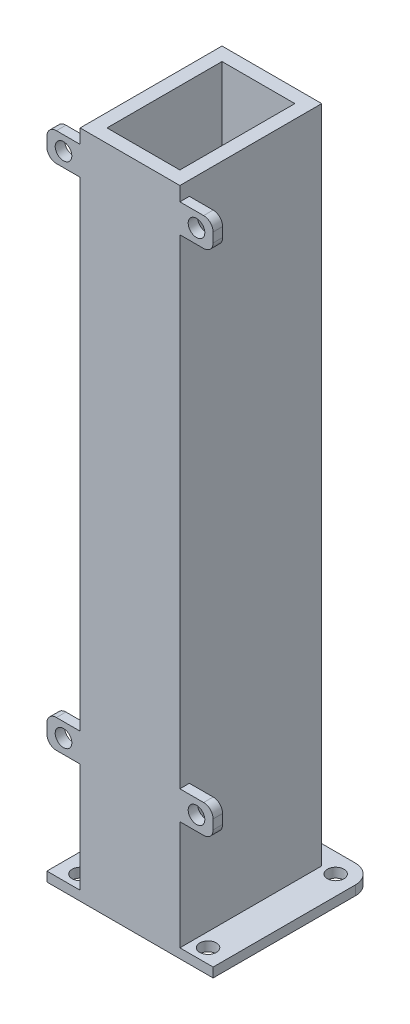
from build123d import *

# Parameters (mm, degrees)
ESQUISSE1_W                   = 35
ESQUISSE1_H                   = 35
BOSS_EXTRU_1_DEPTH            = 2
ESQUISSE2_R                   = 1.75
ESQUISSE2_W                   = 35
ESQUISSE2_H                   = 1.064971157
ENL_V_MAT_EXTRU_1_DEPTH       = 2
BOSS_EXTRU_2_DEPTH            = 280
ESQUISSE5_W                   = 7
ESQUISSE5_H                   = 6
ESQUISSE5_R                   = 1.75
BOSS_EXTRU_3_DEPTH            = 2
ESQUISSE6_R                   = 1.75
BOSS_EXTRU_4_DEPTH            = 2
ESQUISSE10_W                  = 35
ESQUISSE10_H                  = 33.935028843
ESQUISSE10_R                  = 1.75
BOSS_EXTRU_5_DEPTH            = 2
ESQUISSE15_R                  = 6.5
ESQUISSE15_R_2                = 1.75
ENL_V_MAT_EXTRU_2_DEPTH       = 373
CONG_1_R                      = 2
CONG_2_R                      = 4
EXTRU_MINCE1_START            = -2
EXTRU_MINCE1_OUTLINE_W        = 35
EXTRU_MINCE1_OUTLINE_H        = 10
EXTRU_MINCE1_DEPTH            = 2
BOSS_EXTRU_7_DEPTH            = 62.5
BOSS_EXTRU_8_DEPTH            = 160
ENL_V_MAT_EXTRU_4_DEPTH       = 15
BOSS_EXTRU_31_DEPTH           = 69.5
BOSS_EXTRU_31_DEPTH_BACK      = 90.5
ESQUISSE29_W                  = 0.210775501
ESQUISSE29_H                  = 2
BOSS_EXTRU_32_DEPTH           = 160
ENL_V_MAT_EXTRU_7_DEPTH       = 10
ENL_V_MAT_EXTRU_7_DEPTH_BACK  = 5
ESQUISSE34_W                  = 144
ESQUISSE34_H                  = 64.710678118
ENL_V_MAT_EXTRU_8_DEPTH       = 2
ESQUISSE35_R                  = 1.5
BOSS_EXTRU_35_DEPTH           = 2
BOSS_EXTRU_36_START           = -2
ESQUISSE36_R                  = 1.5
BOSS_EXTRU_36_DEPTH           = 2
BOSS_EXTRU_37_DEPTH           = 21
BOSS_EXTRU_38_DEPTH           = 28
ESQUISSE42_W                  = 17
ESQUISSE42_H                  = 6
ENL_V_MAT_EXTRU_9_DEPTH       = 124
ESQUISSE43_R                  = 1.1
ENL_V_MAT_EXTRU_11_DEPTH      = 50
ESQUISSE45_R                  = 1.5
ENL_V_MAT_EXTRU_12_DEPTH      = 50
ESQUISSE47_R                  = 1.75
BOSS_EXTRU_40_DEPTH           = 2
ENL_V_MAT_EXTRU_13_DEPTH      = 2
ESQUISSE49_R                  = 1.75
BOSS_EXTRU_41_DEPTH           = 2
ESQUISSE50_W                  = 12.927363302
ESQUISSE50_H                  = 18
ENL_V_MAT_EXTRU_14_DEPTH      = 2
ESQUISSE51_R                  = 1.75
BOSS_EXTRU_42_DEPTH           = 2
ENL_V_MAT_EXTRU_15_DEPTH      = 1000
ENL_V_MAT_EXTRU_15_DEPTH_BACK = 1000
ESQUISSE53_W                  = 15.34314575
ESQUISSE53_H                  = 24.213203648
ENL_V_MAT_EXTRU_16_DEPTH      = 20


# Read off the part's stored shape, not the designer's step: Extru.-Mince1
with BuildPart() as part:
    # Esquisse1 → Boss.-Extru.1 (new body)
    with BuildSketch(Plane(origin=(0, 0, 0), x_dir=(1, 0, 0), z_dir=(0, 1, 0))):
        with Locations((17.5, -17.5)):
            Rectangle(ESQUISSE1_W, ESQUISSE1_H)
    extrude(amount=BOSS_EXTRU_1_DEPTH)

    # Esquisse2 → Enlèv. mat.-Extru.1 (cut)
    with BuildSketch(Plane(origin=(0, 2, 0), x_dir=(1, 0, 0), z_dir=(0, 1, 0))):
        with Locations(Location((30.935029054, -4.064971369, 0), (0, 0, 270))):
            Circle(ESQUISSE2_R)
        with Locations(Location((30.935028843, -30.935028843, 0), (0, 0, 270))):
            Circle(ESQUISSE2_R)
        with Locations(Location((4.064971369, -4.064970946, 0), (0, 0, 270))):
            Circle(ESQUISSE2_R)
        with Locations(Location((4.064971157, -30.935028843, 0), (0, 0, 270))):
            Circle(ESQUISSE2_R)
        with Locations((17.5, -34.467514421)):
            Rectangle(ESQUISSE2_W, ESQUISSE2_H)
    extrude(amount=-ENL_V_MAT_EXTRU_1_DEPTH, mode=Mode.SUBTRACT)

    # Esquisse4 → Boss.-Extru.2 (add)
    with BuildSketch(Plane(origin=(0, 2, 0), x_dir=(1, 0, 0), z_dir=(0, 1, 0))):
        Polygon((17.5, -33.935028843), (7, -33.935028843), (7, -4.064970946), (28, -4.064970946), (28, -33.935028843), align=None)
    extrude(amount=BOSS_EXTRU_2_DEPTH)

    # Esquisse5 → Boss.-Extru.3 (add)
    # profile 1 of 4: a face of its own
    with BuildSketch(Plane.XY.offset(33.935028843)):
        with Locations((31.5, 254)):
            Rectangle(ESQUISSE5_W, ESQUISSE5_H)
        with Locations((31.5, 254)):
            Circle(ESQUISSE5_R, mode=Mode.SUBTRACT)
    # profile 2 of 4: a face of its own
    with BuildSketch(Plane.XY.offset(33.935028843)):
        with Locations((3.5, 254)):
            Rectangle(ESQUISSE5_W, ESQUISSE5_H)
        with Locations((3.5, 254)):
            Circle(ESQUISSE5_R, mode=Mode.SUBTRACT)
    # profile 3 of 4: a face of its own
    with BuildSketch(Plane.XY.offset(33.935028843)):
        with Locations((31.5, 28)):
            Rectangle(ESQUISSE5_W, ESQUISSE5_H)
        with Locations((31.5, 28)):
            Circle(ESQUISSE5_R, mode=Mode.SUBTRACT)
    # profile 4 of 4: a face of its own
    with BuildSketch(Plane.XY.offset(33.935028843)):
        with Locations((3.5, 28)):
            Rectangle(ESQUISSE5_W, ESQUISSE5_H)
        with Locations((3.5, 28)):
            Circle(ESQUISSE5_R, mode=Mode.SUBTRACT)
    extrude(amount=-BOSS_EXTRU_3_DEPTH)

    # Esquisse6 → Boss.-Extru.4 (add)
    # profile 1 of 2: a face of its own
    with BuildSketch(Plane.XY.offset(33.935028843)):
        Polygon((7, 144), (0, 144), (0, 141), (0, 138), (7, 138), (7, 141), align=None)
        with Locations((3.5, 141)):
            Circle(ESQUISSE6_R, mode=Mode.SUBTRACT)
    # profile 2 of 2: a face of its own
    with BuildSketch(Plane.XY.offset(33.935028843)):
        Polygon((35, 144), (28, 144), (28, 141), (28, 138), (35, 138), (35, 141), align=None)
        with Locations((31.5, 141)):
            Circle(ESQUISSE6_R, mode=Mode.SUBTRACT)
    extrude(amount=-BOSS_EXTRU_4_DEPTH)

    # Esquisse10 → Boss.-Extru.5 (add)
    with BuildSketch(Plane(origin=(0, 282, 0), x_dir=(1, 0, 0), z_dir=(0, 1, 0))):
        with Locations((17.5, -16.967514422)):
            Rectangle(ESQUISSE10_W, ESQUISSE10_H)
        with Locations(Location((30.935028843, -30.935028843, 0), (0, 0, 270))):
            Circle(ESQUISSE10_R, mode=Mode.SUBTRACT)
        with Locations(Location((30.935028631, -4.064970946, 0), (0, 0, 270.000013863))):
            Circle(ESQUISSE10_R, mode=Mode.SUBTRACT)
        with Locations(Location((4.064970946, -4.064971369, 0), (0, 0, 270.000013863))):
            Circle(ESQUISSE10_R, mode=Mode.SUBTRACT)
        with Locations(Location((4.064971157, -30.935028843, 0), (0, 0, 270))):
            Circle(ESQUISSE10_R, mode=Mode.SUBTRACT)
    extrude(amount=-BOSS_EXTRU_5_DEPTH)

    # Esquisse15 → Enlèv. mat.-Extru.2 (cut)
    with BuildSketch(Plane(origin=(0, 282, 0), x_dir=(1, 0, 0), z_dir=(0, 1, 0))):
        with Locations(Location((17.5, -17.5, 0), (0, 0, 270))):
            Circle(ESQUISSE15_R)
        with Locations(Location((30.935029054, -4.064971369, 0), (0, 0, 270))):
            Circle(ESQUISSE15_R_2)
    extrude(amount=-ENL_V_MAT_EXTRU_2_DEPTH, mode=Mode.SUBTRACT)

    # Congé1
    cong_1_edges = [part.edges().sort_by_distance(p)[0] for p in [
        (0, 31, 32.935028843),
        (0, 25, 32.935028843),
        (0, 144, 32.935028843),
        (0, 138, 32.935028843),
        (35, 144, 32.935028843),
        (35, 138, 32.935028843),
        (35, 257, 32.935028843),
        (35, 251, 32.935028843),
        (0, 251, 32.935028843),
        (0, 257, 32.935028843),
        (35, 31, 32.935028843),
        (35, 25, 32.935028843),
    ]]
    fillet(cong_1_edges, radius=CONG_1_R)

    # Congé2
    cong_2_edges = [part.edges().sort_by_distance(p)[0] for p in [
        (35, 281, 0),
        (0, 281, 0),
        (0, 1, 0),
        (35, 1, 0),
    ]]
    fillet(cong_2_edges, radius=CONG_2_R)

    # Extru.-Mince1 outline → Extru.-Mince1 (add)
    with BuildSketch(Plane(origin=(0, 282, 0), x_dir=(1, 0, 0), z_dir=(0, 1, 0)).offset(EXTRU_MINCE1_START)):
        with Locations((17.5, -38.935028843)):
            Rectangle(EXTRU_MINCE1_OUTLINE_W, EXTRU_MINCE1_OUTLINE_H)
    extrude(amount=EXTRU_MINCE1_DEPTH)

    # Esquisse20 → Boss.-Extru.7 (add)
    with BuildSketch(Plane.ZY):
        Polygon((43.935028843, 282), (114.645706961, 211.289321881), (110.645706961, 211.289321881), (41.935028843, 280), (34.145804344, 280), (34.145804344, 282), align=None)
    extrude(amount=BOSS_EXTRU_7_DEPTH)

    # Esquisse21 → Boss.-Extru.8 (add)
    with BuildSketch(Plane.ZY.offset(62.5)):
        Polygon((34.145804344, 280), (41.935028843, 280), (110.645706961, 211.289321881), (114.645706961, 211.289321881), (43.935028843, 282), (34.145804344, 282), align=None)
    extrude(amount=-BOSS_EXTRU_8_DEPTH)

    # Esquisse22 → Enlèv. mat.-Extru.4 (cut)
    with BuildSketch(Plane(origin=(0, 162.967514421, 162.967514421), x_dir=(1, 0, 0), z_dir=(0, 0.7071067811865462, 0.7071067811865488))):
        Polygon((-42.064466094, 147.626821562), (-45.6, 147.626821562), (-45.6, 89.047889374), (-42.064466094, 89.047889374), (-42.064466094, 85.512355468), (77.064466094, 85.512355468), (77.064466094, 89.047889374), (80.6, 89.047889374), (80.6, 147.626821562), (77.064466094, 147.626821562), (77.064466094, 151.162355468), (-42.064466094, 151.162355468), align=None)
    extrude(amount=-ENL_V_MAT_EXTRU_4_DEPTH, mode=Mode.SUBTRACT)

    # Esquisse29 → Boss.-Extru.31 (add, two sides: drawn at the far end of the back side and taken through both)
    with BuildSketch(Plane.ZY.offset(-7).offset(-BOSS_EXTRU_31_DEPTH_BACK)):
        with Locations((34.040416594, 281)):
            Rectangle(ESQUISSE29_W, ESQUISSE29_H)
    extrude(amount=BOSS_EXTRU_31_DEPTH + BOSS_EXTRU_31_DEPTH_BACK)

    # Esquisse32 → Boss.-Extru.32 (add)
    with BuildSketch(Plane.ZY.offset(62.5)):
        Polygon((110.645706961, 211.289321881), (33.935028843, 211.289321881), (33.935028843, 280), (35.935028843, 280), (35.935028843, 213.289321881), (108.645706961, 213.289321881), align=None)
    extrude(amount=-BOSS_EXTRU_32_DEPTH)

    # Esquisse33 → Enlèv. mat.-Extru.7 (cut, two sides: drawn at the far end of the back side and taken through both)
    with BuildSketch(Plane(origin=(0, 0, 33.935028843), x_dir=(-1, 0, 0), z_dir=(0, 0, -1)).offset(-ENL_V_MAT_EXTRU_7_DEPTH_BACK)):
        Polygon((-28, 274.000000001), (-89.5, 274.000000001), (-89.5, 219.289321881), (-81.5, 219.289321881), (-28, 219.289321881), align=None)
        with BuildLine():
            Line((54.5, 274.000000001), (-7, 274.000000001))
            Line((-7, 274.000000001), (-7, 257))
            Line((-7, 257), (-2, 257))
            ThreePointArc((-2, 257), (-0.585786438, 256.414213562), (0, 255))
            Line((0, 255), (0, 253))
            ThreePointArc((0, 253), (-0.585786438, 251.585786438), (-2, 251))
            Line((-2, 251), (-7, 251))
            Line((-7, 251), (-7, 219.289321881))
            Line((-7, 219.289321881), (1, 219.289321881))
            Line((1, 219.289321881), (54.5, 219.289321881))
            Line((54.5, 219.289321881), (54.5, 274.000000001))
        make_face()
        with BuildLine():
            Line((-2, 257), (-7, 257))
            Line((-7, 257), (-7, 251))
            Line((-7, 251), (-2, 251))
            ThreePointArc((-2, 251), (-0.585786438, 251.585786438), (0, 253))
            Line((0, 253), (0, 255))
            ThreePointArc((0, 255), (-0.585786438, 256.414213562), (-2, 257))
        make_face()
    extrude(amount=ENL_V_MAT_EXTRU_7_DEPTH + ENL_V_MAT_EXTRU_7_DEPTH_BACK, mode=Mode.SUBTRACT)

    # Esquisse34 → Enlèv. mat.-Extru.8 (cut)
    with BuildSketch(Plane.XZ.offset(-211.289321881)):
        with Locations((17.5, 74.290367902)):
            Rectangle(ESQUISSE34_W, ESQUISSE34_H)
    extrude(amount=-ENL_V_MAT_EXTRU_8_DEPTH, mode=Mode.SUBTRACT)

    # Esquisse35 → Boss.-Extru.35 (add)
    with BuildSketch(Plane(origin=(97.5, 0, 0), x_dir=(0, 0, -1), z_dir=(1, 0, 0))):
        Polygon((-35.935028843, 280), (-35.935028843, 274.000000001), (-35.935028843, 213.289321881), (-108.645706961, 213.289321881), (-102.645706961, 219.289321881), (-41.935028842, 219.289321881), (-41.935028842, 274.000000001), (-47.935028841, 274.000000001), (-41.935028843, 280), align=None)
        with Locations((-38.935028842, 216.289321881)):
            Circle(ESQUISSE35_R, mode=Mode.SUBTRACT)
        with Locations((-38.935028842, 277.000000001)):
            Circle(ESQUISSE35_R, mode=Mode.SUBTRACT)
        with Locations((-99.645706961, 216.289321881)):
            Circle(ESQUISSE35_R, mode=Mode.SUBTRACT)
    extrude(amount=-BOSS_EXTRU_35_DEPTH)

    # Esquisse36 → Boss.-Extru.36 (add)
    with BuildSketch(Plane.ZY.offset(62.5).offset(BOSS_EXTRU_36_START)):
        Polygon((35.935028843, 213.289321881), (108.645706961, 213.289321881), (102.645706961, 219.289321881), (41.935028842, 219.289321881), (41.935028842, 274.000000001), (47.935028841, 274.000000001), (41.935028843, 280), (35.935028843, 280), (35.935028843, 274.000000001), align=None)
        with Locations(Location((99.645706961, 216.289321881, 0), (0, 0, 180))):
            Circle(ESQUISSE36_R, mode=Mode.SUBTRACT)
        with Locations(Location((38.935028842, 277.000000001, 0), (0, 0, 180))):
            Circle(ESQUISSE36_R, mode=Mode.SUBTRACT)
        with Locations(Location((38.935028842, 216.289321881, 0), (0, 0, 180))):
            Circle(ESQUISSE36_R, mode=Mode.SUBTRACT)
    extrude(amount=BOSS_EXTRU_36_DEPTH)

    # Esquisse39 → Boss.-Extru.37 (add)
    with BuildSketch(Plane(origin=(28, 0, 0), x_dir=(0, 0, -1), z_dir=(1, 0, 0))):
        Polygon((-33.935028843, 211.289321881), (-33.935028843, 191.289321881), (-118.935028843, 201.289321881), (-118.935028843, 211.289321881), align=None)
    extrude(amount=-BOSS_EXTRU_37_DEPTH)

    # Esquisse40 → Boss.-Extru.38 (add)
    with BuildSketch(Plane.XY.offset(118.935028843)):
        Polygon((7, 201.289321881), (2, 201.289321881), (2, 203.289321881), (33, 203.289321881), (33, 201.289321881), (28, 201.289321881), align=None)
    extrude(amount=BOSS_EXTRU_38_DEPTH)

    # Esquisse42 → Enlèv. mat.-Extru.9 (cut)
    with BuildSketch(Plane.XY.offset(118.935028843)):
        with Locations((17.5, 208.289321881)):
            Rectangle(ESQUISSE42_W, ESQUISSE42_H)
    extrude(amount=-ENL_V_MAT_EXTRU_9_DEPTH, mode=Mode.SUBTRACT)

    # Esquisse43 → Enlèv. mat.-Extru.11 (cut)
    with BuildSketch(Plane(origin=(0, 203.289321881, 0), x_dir=(1, 0, 0), z_dir=(0, 1, 0))):
        with Locations(Location((5, -144.935028843, 0), (0, 0, 270))):
            Circle(ESQUISSE43_R)
        with Locations(Location((30, -144.935028843, 0), (0, 0, 270))):
            Circle(ESQUISSE43_R)
        with Locations(Location((5, -130.435028843, 0), (0, 0, 270))):
            Circle(ESQUISSE43_R)
        with Locations(Location((30, -130.435028843, 0), (0, 0, 270))):
            Circle(ESQUISSE43_R)
        with BuildLine():
            Line((5, -123.319506434), (5, -128.435028843))
            ThreePointArc((5, -128.435028843), (7, -130.435028843), (5, -132.435028843))
            Line((5, -132.435028843), (5, -142.935028843))
            ThreePointArc((5, -142.935028843), (6.414213562, -143.52081528), (7, -144.935028843))
            Line((7, -144.935028843), (28, -144.935028843))
            ThreePointArc((28, -144.935028843), (28.585786438, -143.52081528), (30, -142.935028843))
            Line((30, -142.935028843), (30, -132.435028843))
            ThreePointArc((30, -132.435028843), (28, -130.435028843), (30, -128.435028843))
            Line((30, -128.435028843), (30, -123.319506434))
            Line((30, -123.319506434), (5, -123.319506434))
        make_face()
    extrude(amount=-ENL_V_MAT_EXTRU_11_DEPTH, mode=Mode.SUBTRACT)

    # Esquisse45 → Enlèv. mat.-Extru.12 (cut)
    with BuildSketch(Plane(origin=(0, 162.967514421, 162.967514421), x_dir=(1, 0, 0), z_dir=(0, 0.7071067811865462, 0.7071067811865488))):
        with Locations(Location((80.6, 151.162355468, 0), (0, 0, 270))):
            Circle(ESQUISSE45_R)
        with Locations(Location((80.6, 85.512355468, 0), (0, 0, 270))):
            Circle(ESQUISSE45_R)
        with Locations(Location((-45.6, 85.512355468, 0), (0, 0, 270))):
            Circle(ESQUISSE45_R)
        with Locations(Location((-45.6, 151.162355468, 0), (0, 0, 270))):
            Circle(ESQUISSE45_R)
    extrude(amount=-ENL_V_MAT_EXTRU_12_DEPTH, mode=Mode.SUBTRACT)

    # Esquisse47 → Boss.-Extru.40 (add)
    # profile 1 of 4: a face of its own
    with BuildSketch(Plane.XY.offset(33.935028843)):
        with BuildLine():
            Line((2, 144), (7, 144))
            Line((7, 144), (7, 150))
            Line((7, 150), (2, 150))
            ThreePointArc((2, 150), (0.585786438, 149.414213562), (0, 148))
            Line((0, 148), (0, 146))
            ThreePointArc((0, 146), (0.585786438, 144.585786438), (2, 144))
        make_face()
        with Locations((3.5, 147)):
            Circle(ESQUISSE47_R, mode=Mode.SUBTRACT)
    # profile 2 of 4: a face of its own
    with BuildSketch(Plane.XY.offset(33.935028843)):
        with BuildLine():
            Line((28, 150), (28, 144))
            Line((28, 144), (33, 144))
            ThreePointArc((33, 144), (34.414213562, 144.585786438), (35, 146))
            Line((35, 146), (35, 148))
            ThreePointArc((35, 148), (34.414213562, 149.414213562), (33, 150))
            Line((33, 150), (28, 150))
        make_face()
        with Locations((31.5, 147)):
            Circle(ESQUISSE47_R, mode=Mode.SUBTRACT)
    # profile 3 of 4: a face of its own
    with BuildSketch(Plane.XY.offset(33.935028843)):
        with BuildLine():
            Line((35, 134), (35, 136))
            ThreePointArc((35, 136), (34.414213562, 137.414213562), (33, 138))
            Line((33, 138), (28, 138))
            Line((28, 138), (28, 132))
            Line((28, 132), (33, 132))
            ThreePointArc((33, 132), (34.414213562, 132.585786438), (35, 134))
        make_face()
        with Locations((31.5, 135)):
            Circle(ESQUISSE47_R, mode=Mode.SUBTRACT)
    # profile 4 of 4: a face of its own
    with BuildSketch(Plane.XY.offset(33.935028843)):
        with BuildLine():
            Line((7, 138), (2, 138))
            ThreePointArc((2, 138), (0.585786438, 137.414213562), (0, 136))
            Line((0, 136), (0, 134))
            ThreePointArc((0, 134), (0.585786438, 132.585786438), (2, 132))
            Line((2, 132), (7, 132))
            Line((7, 132), (7, 138))
        make_face()
        with Locations((3.5, 135)):
            Circle(ESQUISSE47_R, mode=Mode.SUBTRACT)
    extrude(amount=-BOSS_EXTRU_40_DEPTH)

    # Esquisse48 → Enlèv. mat.-Extru.13 (cut)
    with BuildSketch(Plane.XY.offset(33.935028843)):
        Polygon((-4.556540033, 144), (-4.556540033, 138), (2, 138), (7, 138), (7, 144), (2, 144), align=None)
        Polygon((33.295178048, 144), (39.851718081, 144), (39.851718081, 138), (33.295178048, 138), (28.295178048, 138), (28.295178048, 144), align=None)
    extrude(amount=-ENL_V_MAT_EXTRU_13_DEPTH, mode=Mode.SUBTRACT)

    # Esquisse49 → Boss.-Extru.41 (add)
    # profile 1 of 2: a face of its own
    with BuildSketch(Plane.XY.offset(33.935028843)):
        with BuildLine():
            Line((2, 180.289321881), (7, 180.289321881))
            Line((7, 180.289321881), (7, 186.289321881))
            Line((7, 186.289321881), (2, 186.289321881))
            ThreePointArc((2, 186.289321881), (0.585786438, 185.703535444), (0, 184.289321881))
            Line((0, 184.289321881), (0, 182.289321881))
            ThreePointArc((0, 182.289321881), (0.585786438, 180.875108319), (2, 180.289321881))
        make_face()
        with Locations((3.5, 183.289321881)):
            Circle(ESQUISSE49_R, mode=Mode.SUBTRACT)
    # profile 2 of 2: a face of its own
    with BuildSketch(Plane.XY.offset(33.935028843)):
        with BuildLine():
            Line((35, 182.289321881), (35, 184.289321881))
            ThreePointArc((35, 184.289321881), (34.414213562, 185.703535444), (33, 186.289321881))
            Line((33, 186.289321881), (28, 186.289321881))
            Line((28, 186.289321881), (28, 180.289321881))
            Line((28, 180.289321881), (33, 180.289321881))
            ThreePointArc((33, 180.289321881), (34.414213562, 180.875108319), (35, 182.289321881))
        make_face()
        with Locations((31.5, 183.289321881)):
            Circle(ESQUISSE49_R, mode=Mode.SUBTRACT)
    extrude(amount=-BOSS_EXTRU_41_DEPTH)

    # Esquisse50 → Enlèv. mat.-Extru.14 (cut)
    with BuildSketch(Plane.XY.offset(33.935028843)):
        with Locations((34.463681651, 141)):
            Rectangle(ESQUISSE50_W, ESQUISSE50_H)
    extrude(amount=-ENL_V_MAT_EXTRU_14_DEPTH, mode=Mode.SUBTRACT)

    # Esquisse51 → Boss.-Extru.42 (add)
    # profile 1 of 3: a face of its own
    with BuildSketch(Plane.XY.offset(33.935028843)):
        with BuildLine():
            Line((7, 150), (7, 144))
            Line((7, 144), (2, 144))
            ThreePointArc((2, 144), (0.585786438, 144.585786438), (0, 146))
            Line((0, 146), (0, 148))
            ThreePointArc((0, 148), (0.585786438, 149.414213562), (2, 150))
            Line((2, 150), (7, 150))
        make_face()
        with Locations((3.5, 147)):
            Circle(ESQUISSE51_R, mode=Mode.SUBTRACT)
    # profile 2 of 3: a face of its own
    with BuildSketch(Plane.XY.offset(33.935028843)):
        with BuildLine():
            Line((33, 138.018442997), (28, 138.018442997))
            Line((28, 138.018442997), (28, 132.018442997))
            Line((28, 132.018442997), (33, 132.018442997))
            ThreePointArc((33, 132.018442997), (34.414213562, 132.604229434), (35, 134.018442997))
            Line((35, 134.018442997), (35, 136.018442997))
            ThreePointArc((35, 136.018442997), (34.414213562, 137.432656559), (33, 138.018442997))
        make_face()
        with Locations((31.5, 135.018442997)):
            Circle(ESQUISSE51_R, mode=Mode.SUBTRACT)
    # profile 3 of 3: a face of its own
    with BuildSketch(Plane.XY.offset(33.935028843)):
        with BuildLine():
            Line((33, 150), (28, 150))
            Line((28, 150), (28, 144))
            Line((28, 144), (33, 144))
            ThreePointArc((33, 144), (34.414213562, 144.585786438), (35, 146))
            Line((35, 146), (35, 148))
            ThreePointArc((35, 148), (34.414213562, 149.414213562), (33, 150))
        make_face()
        with Locations((31.5, 147)):
            Circle(ESQUISSE51_R, mode=Mode.SUBTRACT)
    extrude(amount=-BOSS_EXTRU_42_DEPTH)

    # Esquisse52 → Enlèv. mat.-Extru.15 (cut, two sides: drawn at the far end of the back side and taken through both)
    with BuildSketch(Plane.XY.offset(33.935028843).offset(-ENL_V_MAT_EXTRU_15_DEPTH_BACK)):
        Polygon((178.674523554, 141), (7, 141), (-154.270399125, 141), (-154.270399125, 365.360824734), (178.674523554, 365.360824734), align=None)
    extrude(amount=ENL_V_MAT_EXTRU_15_DEPTH + ENL_V_MAT_EXTRU_15_DEPTH_BACK, mode=Mode.SUBTRACT)

    # Esquisse53 → Enlèv. mat.-Extru.16 (cut)
    with BuildSketch(Plane(origin=(0, 141, 0), x_dir=(1, 0, 0), z_dir=(0, 1, 0))):
        with Locations((17.5, -18.999999894)):
            Rectangle(ESQUISSE53_W, ESQUISSE53_H)
    extrude(amount=-ENL_V_MAT_EXTRU_16_DEPTH, mode=Mode.SUBTRACT)


solid = part.part
